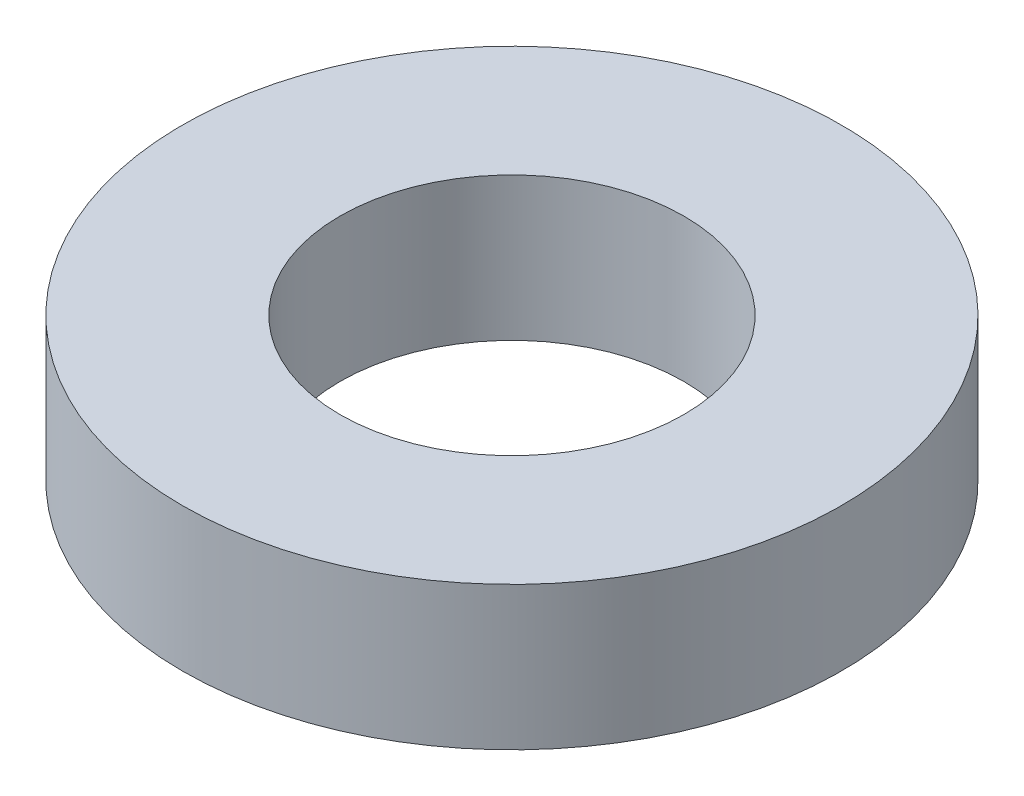
from build123d import *

# Parameters (mm, degrees)
SKETCH1_R           = 57.5
BOSS_EXTRUDE1_DEPTH = 25
SKETCH2_R           = 30
CUT_EXTRUDE1_DEPTH  = 86.073497636


with BuildPart() as part:
    # Sketch1 → Boss-Extrude1 (new body)
    with BuildSketch(Plane(origin=(0, 0, 0), x_dir=(1, 0, 0), z_dir=(0, 1, 0))):
        Circle(SKETCH1_R)
    extrude(amount=BOSS_EXTRUDE1_DEPTH)

    # Sketch2 → Cut-Extrude1 (cut, through all)
    with BuildSketch(Plane(origin=(0, 0, 0), x_dir=(1, 0, 0), z_dir=(0, 1, 0))):
        Circle(SKETCH2_R)
    extrude(amount=CUT_EXTRUDE1_DEPTH, mode=Mode.SUBTRACT)


solid = part.part
